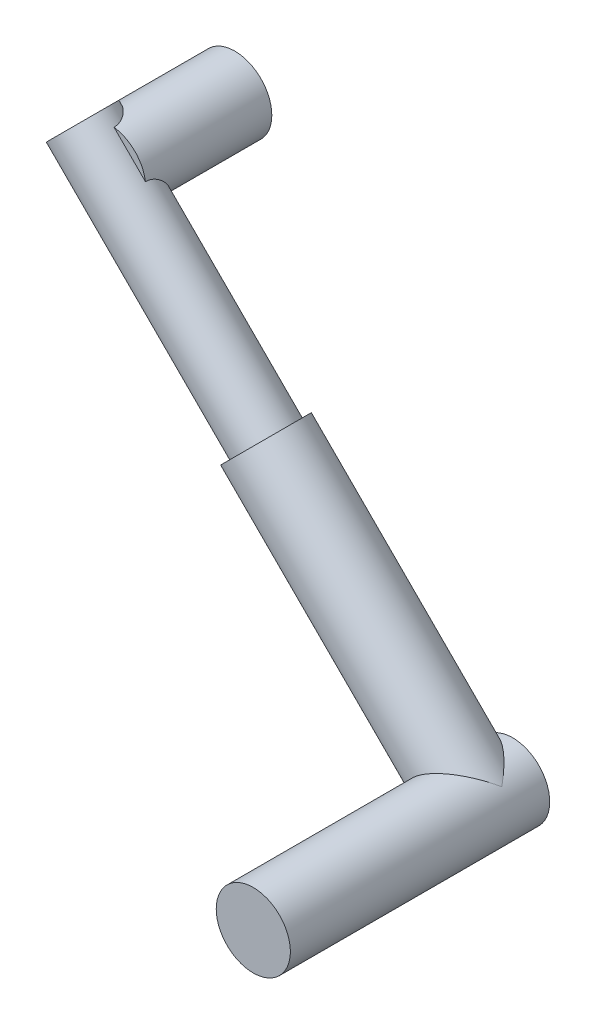
from build123d import *

# Parameters (mm, degrees)
SKETCH2_R                = 25
BOSS_EXTRUDE1_DEPTH      = 85
SKETCH6_R                = 20
BOSS_EXTRUDE4_DEPTH      = 175
SKETCH7_R                = 25
BOSS_EXTRUDE5_DEPTH      = 200
BOSS_EXTRUDE6_DEPTH      = 25
BOSS_EXTRUDE6_DEPTH_BACK = 150
SKETCH8_R                = 25


with BuildPart() as part:
    # Sketch2 → Boss-Extrude1 (new body)
    with BuildSketch(Plane.XY):
        Circle(SKETCH2_R)
    extrude(amount=BOSS_EXTRUDE1_DEPTH)

    # Sketch6 → Boss-Extrude4 (add)
    with BuildSketch(Plane(origin=(-17.67766953, 17.67766953, 0), x_dir=(0, 0, -1), z_dir=(-0.7071067811865488, 0.7071067811865464, 0))):
        with Locations((-84.993726281, 0)):
            Circle(SKETCH6_R)
    extrude(amount=-BOSS_EXTRUDE4_DEPTH)

    # Sketch7 → Boss-Extrude5 (add)
    with BuildSketch(Plane(origin=(106.066017178, -106.066017178, 0), x_dir=(0, 0, -1), z_dir=(0.7071067811865487, -0.7071067811865465, 0))):
        with Locations((-84.993726281, 0)):
            Circle(SKETCH7_R)
    extrude(amount=BOSS_EXTRUDE5_DEPTH)

    # Sketch8 → Boss-Extrude6 (add, two sides: drawn at the far end of the back side and taken through both)
    with BuildSketch(Plane(origin=(0, 0, 84.993726281), x_dir=(-0.7071067811865487, 0.7071067811865465, 0), z_dir=(0, 0, -1)).offset(-BOSS_EXTRUDE6_DEPTH_BACK)):
        with Locations((-350, 0)):
            Circle(SKETCH8_R)
    extrude(amount=BOSS_EXTRUDE6_DEPTH + BOSS_EXTRUDE6_DEPTH_BACK)


solid = part.part
